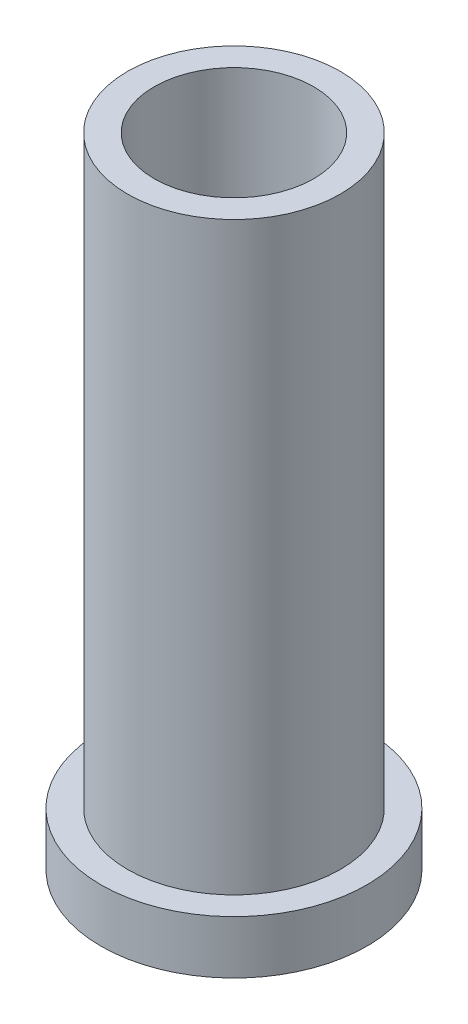
from build123d import *

# Parameters (mm, degrees)
SKETCH2_R           = 50.8
SKETCH2_R_2         = 38.1
BOSS_EXTRUDE1_DEPTH = 304.8
SKETCH4_R           = 63.5
SKETCH4_R_2         = 38.1
BOSS_EXTRUDE3_DEPTH = 25.4


with BuildPart() as part:
    # Sketch2 → Boss-Extrude1 (new body)
    with BuildSketch(Plane(origin=(0, 0, 0), x_dir=(1, 0, 0), z_dir=(0, 1, 0))):
        Circle(SKETCH2_R)
        Circle(SKETCH2_R_2, mode=Mode.SUBTRACT)
    extrude(amount=BOSS_EXTRUDE1_DEPTH)

    # Sketch4 → Boss-Extrude3 (add)
    with BuildSketch(Plane(origin=(0, 0, 0), x_dir=(1, 0, 0), z_dir=(0, 1, 0))):
        Circle(SKETCH4_R)
        Circle(SKETCH4_R_2, mode=Mode.SUBTRACT)
    extrude(amount=BOSS_EXTRUDE3_DEPTH)


solid = part.part
